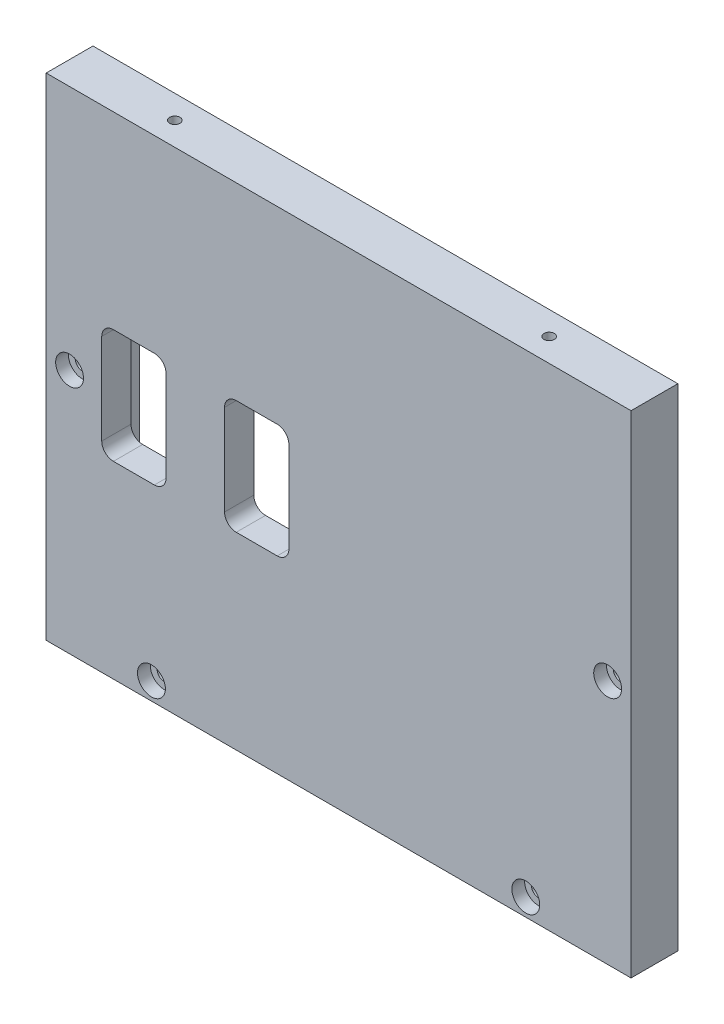
from build123d import *

# Parameters (mm, degrees)
SKETCH1_W                                      = 100
SKETCH1_H                                      = 84
BOSS_EXTRUDE1_DEPTH                            = 8
CBORE_FOR_2_SOCKET_HEAD_CAP_SCREW1_D           = 2.4384
CBORE_FOR_2_SOCKET_HEAD_CAP_SCREW1_DEPTH       = 12.27
CBORE_FOR_2_SOCKET_HEAD_CAP_SCREW1_CBORE_D     = 4.7625
CBORE_FOR_2_SOCKET_HEAD_CAP_SCREW1_CBORE_DEPTH = 2.1844
CBORE_FOR_2_SOCKET_HEAD_CAP_SCREW1_TIP         = 0.732569267
CBORE_FOR_2_SOCKET_HEAD_CAP_SCREW2_D           = 2.4384
CBORE_FOR_2_SOCKET_HEAD_CAP_SCREW2_DEPTH       = 12.27
CBORE_FOR_2_SOCKET_HEAD_CAP_SCREW2_CBORE_D     = 4.7625
CBORE_FOR_2_SOCKET_HEAD_CAP_SCREW2_CBORE_DEPTH = 2.1844
CBORE_FOR_2_SOCKET_HEAD_CAP_SCREW2_TIP         = 0.732569267
F_2_56_TAPPED_HOLE1_D                          = 1.778
F_2_56_TAPPED_HOLE1_DEPTH                      = 12
F_2_56_TAPPED_HOLE1_TIP                        = 0.53416509
SKETCH12_W                                     = 35
SKETCH12_H                                     = 60
CUT_EXTRUDE3_DEPTH                             = 3
FILLET1_R                                      = 2
FILLET2_R                                      = 2
FILLET3_R                                      = 2
FILLET4_R                                      = 2
SKETCH17_W                                     = 11
SKETCH17_H                                     = 19.5
CUT_EXTRUDE4_DEPTH                             = 8
SKETCH16_W                                     = 11
SKETCH16_H                                     = 19.5
CUT_EXTRUDE5_DEPTH                             = 8
FILLET5_R                                      = 2
FILLET6_R                                      = 2
FILLET7_R                                      = 2
FILLET8_R                                      = 2


with BuildPart() as part:
    # Sketch1 → Boss-Extrude1 (new body)
    with BuildSketch(Plane.XY):
        Rectangle(SKETCH1_W, SKETCH1_H)
    extrude(amount=BOSS_EXTRUDE1_DEPTH)

    # CBORE for #2 Socket Head Cap Screw1
    with Locations(Plane(origin=(-32, -39, 8), x_dir=(1, 0, 0), z_dir=(0, 0, 1))):
        with Locations((0, 0), (64, 0)):
            CounterBoreHole(CBORE_FOR_2_SOCKET_HEAD_CAP_SCREW1_D / 2, CBORE_FOR_2_SOCKET_HEAD_CAP_SCREW1_CBORE_D / 2, CBORE_FOR_2_SOCKET_HEAD_CAP_SCREW1_CBORE_DEPTH, depth=CBORE_FOR_2_SOCKET_HEAD_CAP_SCREW1_DEPTH)
            with Locations((0, 0, -(CBORE_FOR_2_SOCKET_HEAD_CAP_SCREW1_DEPTH + CBORE_FOR_2_SOCKET_HEAD_CAP_SCREW1_TIP / 2))):  # 118° drill point
                Cone(0, CBORE_FOR_2_SOCKET_HEAD_CAP_SCREW1_D / 2, CBORE_FOR_2_SOCKET_HEAD_CAP_SCREW1_TIP, mode=Mode.SUBTRACT)

    # CBORE for #2 Socket Head Cap Screw2
    with Locations(Plane(origin=(-46, 0, 8), x_dir=(1, 0, 0), z_dir=(0, 0, 1))):
        with Locations((0, 0), (92, 0)):
            CounterBoreHole(CBORE_FOR_2_SOCKET_HEAD_CAP_SCREW2_D / 2, CBORE_FOR_2_SOCKET_HEAD_CAP_SCREW2_CBORE_D / 2, CBORE_FOR_2_SOCKET_HEAD_CAP_SCREW2_CBORE_DEPTH, depth=CBORE_FOR_2_SOCKET_HEAD_CAP_SCREW2_DEPTH)
            with Locations((0, 0, -(CBORE_FOR_2_SOCKET_HEAD_CAP_SCREW2_DEPTH + CBORE_FOR_2_SOCKET_HEAD_CAP_SCREW2_TIP / 2))):  # 118° drill point
                Cone(0, CBORE_FOR_2_SOCKET_HEAD_CAP_SCREW2_D / 2, CBORE_FOR_2_SOCKET_HEAD_CAP_SCREW2_TIP, mode=Mode.SUBTRACT)

    # #2-56 Tapped Hole1
    with Locations(Plane(origin=(-32, 42, 4), x_dir=(0, 0, 1), z_dir=(0, 1, 0))):
        with Locations((0, 0), (0, 64)):
            Hole(F_2_56_TAPPED_HOLE1_D / 2, depth=F_2_56_TAPPED_HOLE1_DEPTH)
            with Locations((0, 0, -(F_2_56_TAPPED_HOLE1_DEPTH + F_2_56_TAPPED_HOLE1_TIP / 2))):  # 118° drill point
                Cone(0, F_2_56_TAPPED_HOLE1_D / 2, F_2_56_TAPPED_HOLE1_TIP, mode=Mode.SUBTRACT)

    # Sketch12 → Cut-Extrude3 (cut)
    with BuildSketch(Plane(origin=(0, 0, 0), x_dir=(-1, 0, 0), z_dir=(0, 0, -1))):
        with Locations((24.5, 0)):
            Rectangle(SKETCH12_W, SKETCH12_H)
    extrude(amount=-CUT_EXTRUDE3_DEPTH, mode=Mode.SUBTRACT)

    # Fillet1
    fillet1_edges = [part.edges().sort_by_distance(p)[0] for p in [
        (-7, 30, 1.5),
    ]]
    fillet(fillet1_edges, radius=FILLET1_R)

    # Fillet2
    fillet2_edges = [part.edges().sort_by_distance(p)[0] for p in [
        (-42, 30, 1.5),
    ]]
    fillet(fillet2_edges, radius=FILLET2_R)

    # Fillet3
    fillet3_edges = [part.edges().sort_by_distance(p)[0] for p in [
        (-42, -30, 1.5),
    ]]
    fillet(fillet3_edges, radius=FILLET3_R)

    # Fillet4
    fillet4_edges = [part.edges().sort_by_distance(p)[0] for p in [
        (-7, -30, 1.5),
    ]]
    fillet(fillet4_edges, radius=FILLET4_R)

    # Sketch17 → Cut-Extrude4 (cut)
    with BuildSketch(Plane(origin=(0, 0, 3), x_dir=(-1, 0, 0), z_dir=(0, 0, -1))):
        with Locations((35, 0)):
            Rectangle(SKETCH17_W, SKETCH17_H)
    extrude(amount=-CUT_EXTRUDE4_DEPTH, mode=Mode.SUBTRACT)

    # Sketch16 → Cut-Extrude5 (cut)
    with BuildSketch(Plane(origin=(0, 0, 3), x_dir=(-1, 0, 0), z_dir=(0, 0, -1))):
        with Locations((14, 0)):
            Rectangle(SKETCH16_W, SKETCH16_H)
    extrude(amount=-CUT_EXTRUDE5_DEPTH, mode=Mode.SUBTRACT)

    # Fillet5
    fillet5_edges = [part.edges().sort_by_distance(p)[0] for p in [
        (-40.5, 9.75, 5.5),
        (-19.5, 9.75, 5.5),
    ]]
    fillet(fillet5_edges, radius=FILLET5_R)

    # Fillet6
    fillet6_edges = [part.edges().sort_by_distance(p)[0] for p in [
        (-29.5, 9.75, 5.5),
        (-8.5, 9.75, 5.5),
    ]]
    fillet(fillet6_edges, radius=FILLET6_R)

    # Fillet7
    fillet7_edges = [part.edges().sort_by_distance(p)[0] for p in [
        (-29.5, -9.75, 5.5),
        (-8.5, -9.75, 5.5),
    ]]
    fillet(fillet7_edges, radius=FILLET7_R)

    # Fillet8
    fillet8_edges = [part.edges().sort_by_distance(p)[0] for p in [
        (-40.5, -9.75, 5.5),
        (-19.5, -9.75, 5.5),
    ]]
    fillet(fillet8_edges, radius=FILLET8_R)


solid = part.part
